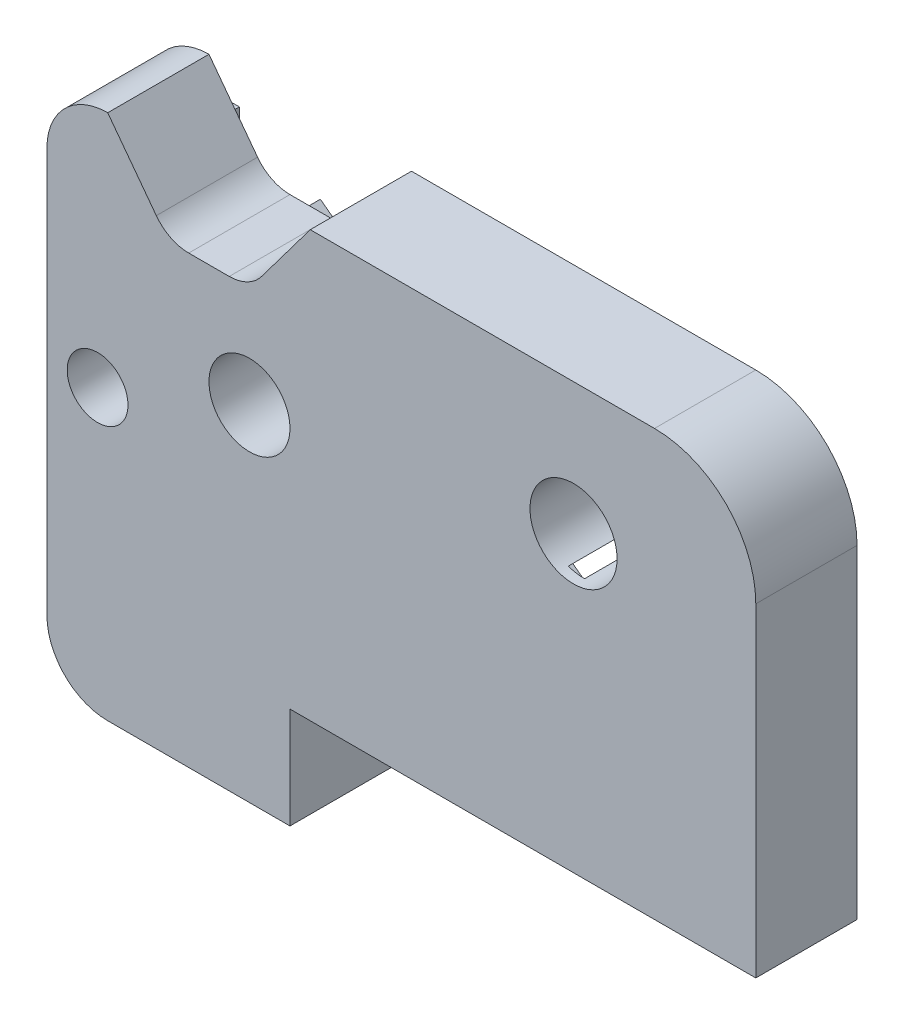
from build123d import *

# Parameters (mm, degrees)
SKETCH1_W             = 23
SKETCH1_H             = 21
EXTRUDE1_DEPTH        = 5
SKETCH2_R             = 2.15
EXTRUDE2_DEPTH        = 4.5
SKETCH4_R             = 1.25
EXTRUDE4_DEPTH        = 8
FILLET1_R             = 5
SKETCH6_R             = 4.5
EXTRUDE6_DEPTH        = 4.5
SKETCH9_W             = 12
SKETCH9_H             = 26
EXTRUDE9_DEPTH        = 5
SKETCH11_R            = 1.5
EXTRUDE11_DEPTH       = 5
SKETCH10_R            = 2
EXTRUDE10_DEPTH       = 4
M3_TAPPED_HOLE1_D     = 2.5
M3_TAPPED_HOLE1_DEPTH = 8
M3_TAPPED_HOLE1_TIP   = 0.751075774
EXTRUDE12_DEPTH       = 4
FILLET3_R             = 3
EXTRUDE14_DEPTH       = 4
FILLET4_R             = 2
EXTRUDE15_DEPTH       = 5
FILLET6_R             = 2


with BuildPart() as part:
    # Sketch1 → Extrude1 (new body)
    with BuildSketch(Plane.XY):
        with Locations((3.5, -4)):
            Rectangle(SKETCH1_W, SKETCH1_H)
    extrude(amount=EXTRUDE1_DEPTH)

    # Sketch2 → Extrude2 (cut)
    with BuildSketch(Plane.XY.offset(5)):
        with Locations((6, 0)):
            Circle(SKETCH2_R)
    extrude(amount=-EXTRUDE2_DEPTH, mode=Mode.SUBTRACT)

    # Sketch4 → Extrude4 (cut)
    with BuildSketch(Plane.XZ.offset(14.5)):
        with Locations(Location((-1.4, 2.5, 0), (0, 0, 270))):
            Circle(SKETCH4_R)
        with Locations(Location((12, 2.5, 0), (0, 0, 270))):
            Circle(SKETCH4_R)
    extrude(amount=-EXTRUDE4_DEPTH, mode=Mode.SUBTRACT)

    # Fillet1
    fillet1_edges = [part.edges().sort_by_distance(p)[0] for p in [
        (15, 6.5, 2.5),
    ]]
    fillet(fillet1_edges, radius=FILLET1_R)

    # Sketch6 → Extrude6 (cut)
    with BuildSketch(Plane(origin=(0, 0, 0), x_dir=(-1, 0, 0), z_dir=(0, 0, -1))):
        with Locations((-4.9, -6.5)):
            Circle(SKETCH6_R)
    extrude(amount=-EXTRUDE6_DEPTH, mode=Mode.SUBTRACT)

    # Sketch9 → Extrude9 (add)
    with BuildSketch(Plane(origin=(0, 0, 0), x_dir=(-1, 0, 0), z_dir=(0, 0, -1))):
        with Locations((14, -6.5)):
            Rectangle(SKETCH9_W, SKETCH9_H)
    extrude(amount=-EXTRUDE9_DEPTH)

    # Sketch11 → Extrude11 (cut)
    with BuildSketch(Plane.XY.offset(5)):
        with Locations((-17.5, -5.5)):
            Circle(SKETCH11_R)
    extrude(amount=-EXTRUDE11_DEPTH, mode=Mode.SUBTRACT)

    # Sketch10 → Extrude10 (cut)
    with BuildSketch(Plane.XY.offset(5)):
        with Locations((-10, -2.5)):
            Circle(SKETCH10_R)
    extrude(amount=-EXTRUDE10_DEPTH, mode=Mode.SUBTRACT)

    # M3 Tapped Hole1
    with Locations(Plane(origin=(-1.4, -14.5, 2.5), x_dir=(0, 0, -1), z_dir=(0, -1, 0))):
        with Locations((0, 0), (0, 13.4)):
            Hole(M3_TAPPED_HOLE1_D / 2, depth=M3_TAPPED_HOLE1_DEPTH)
            with Locations((0, 0, -(M3_TAPPED_HOLE1_DEPTH + M3_TAPPED_HOLE1_TIP / 2))):  # 118° drill point
                Cone(0, M3_TAPPED_HOLE1_D / 2, M3_TAPPED_HOLE1_TIP, mode=Mode.SUBTRACT)

    # Sketch13 → Extrude12 (add)
    with BuildSketch(Plane(origin=(0, 0, 0), x_dir=(-1, 0, 0), z_dir=(0, 0, -1))):
        Polygon((20, -19.5), (8, -19.5), (8, -14.5), (2, -14.5), (2, -11.07), (18.1, 1), (20, 1), align=None)
    extrude(amount=EXTRUDE12_DEPTH)

    # Fillet3
    fillet3_edges = [part.edges().sort_by_distance(p)[0] for p in [
        (-20, -19.5, 0.5),
        (-20, 6.5, 2.5),
    ]]
    fillet(fillet3_edges, radius=FILLET3_R)

    # Sketch14 → Extrude14 (cut)
    with BuildSketch(Plane(origin=(0, 0, -4), x_dir=(-1, 0, 0), z_dir=(0, 0, -1))):
        Polygon((19.5, 1), (19.5, -7.5), (15.5, -7.5), (15.5, -0.949192547), (18.1, 1), align=None)
    extrude(amount=-EXTRUDE14_DEPTH, mode=Mode.SUBTRACT)

    # Fillet4
    fillet4_edges = [part.edges().sort_by_distance(p)[0] for p in [
        (-19.5, -7.5, -2),
        (-15.5, -7.5, -2),
    ]]
    fillet(fillet4_edges, radius=FILLET4_R - 0.0001)  # a hair under: the kernel refuses the full size

    # Sketch15 → Extrude15 (cut)
    with BuildSketch(Plane.XY.offset(5)):
        Polygon((-14, 2.5), (-17, 6.5), (-7, 6.5), (-10, 2.5), align=None)
    extrude(amount=-EXTRUDE15_DEPTH, mode=Mode.SUBTRACT)

    # Fillet6
    fillet6_edges = [part.edges().sort_by_distance(p)[0] for p in [
        (-10, 2.5, 2.5),
        (-14, 2.5, 2.5),
    ]]
    fillet(fillet6_edges, radius=FILLET6_R)


solid = part.part
